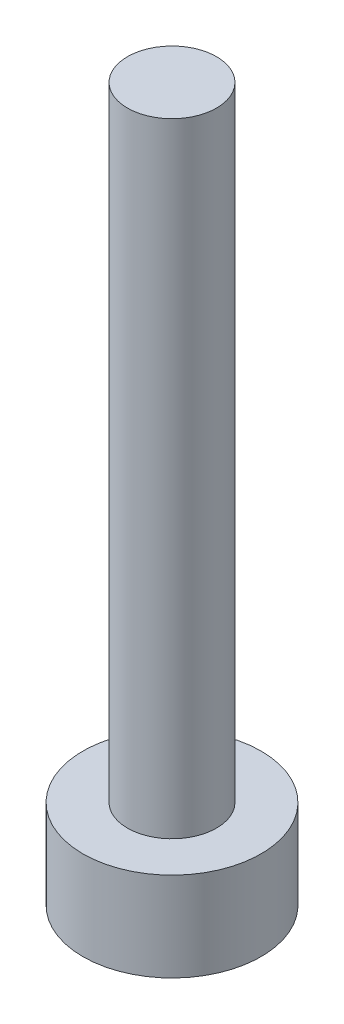
from build123d import *

# Parameters (mm, degrees)
SKETCH17_R           = 5
BOSS_EXTRUDE12_DEPTH = 80
SKETCH17_3_R         = 10
BOSS_EXTRUDE13_DEPTH = 10


with BuildPart() as part:
    # Sketch17 → Boss-Extrude12 (new body)
    with BuildSketch(Plane(origin=(0, 0, 0), x_dir=(1, 0, 0), z_dir=(0, 1, 0))):
        Circle(SKETCH17_R)
    extrude(amount=BOSS_EXTRUDE12_DEPTH)

    # Sketch17<3> → Boss-Extrude13 (add)
    with BuildSketch(Plane(origin=(0, 0, 0), x_dir=(1, 0, 0), z_dir=(0, 1, 0))):
        Circle(SKETCH17_3_R)
    extrude(amount=BOSS_EXTRUDE13_DEPTH)

    # Sketch3<5> → Cut-Revolve3 (revolve, cut)
    with BuildSketch(Plane(origin=(0, 1.9, 0), x_dir=(1, 0, 0), z_dir=(0, 1, 0))):
        with BuildLine():
            Line((0, 5), (0, -5))
            ThreePointArc((0, -5), (5, 0), (0, 5))
        make_face()
    revolve(axis=Axis((0, 1.9, 5), (0, 0, -1)), mode=Mode.SUBTRACT)


solid = part.part
